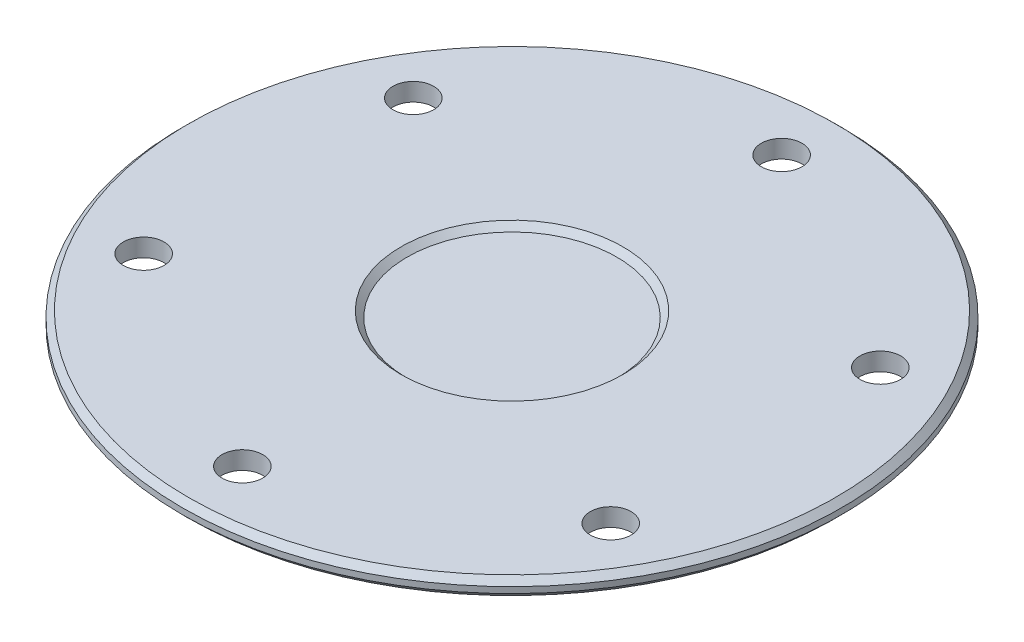
from build123d import *

# Parameters (mm, degrees)
SKETCH_1_R               = 55
EXTRUDE_1_DEPTH          = 3
PATTERN_CIRCULAR_1_COUNT = 6
SKETCH_5_R               = 17.5
CUT_EXTRUDE_1_DEPTH      = 1
CHAMFER_1_SIZE           = 1


with BuildPart() as part:
    # 草图1 → 凸台-拉伸1 (new body)
    with BuildSketch(Plane(origin=(0, 0, 0), x_dir=(1, 0, 0), z_dir=(0, 1, 0))):
        with Locations(Location((0, 0, 0), (0, 0, 270))):
            Circle(SKETCH_1_R)
    extrude(amount=EXTRUDE_1_DEPTH)

    # 草图4 → M8 螺纹孔的螺纹孔钻头1 (revolve, cut)
    with BuildSketch(Plane(origin=(0, 3, -45), x_dir=(0, 0, 1), z_dir=(1, 0, 0))):
        Polygon((0, 0), (0, 18.042926105), (3.4, 16), (3.4, 0), align=None)
    hole_wizard_m8_1 = revolve(axis=Axis((0, 9.35, -45), (0, -1, 0)), mode=Mode.SUBTRACT)

    # 阵列(圆周)1: M8 螺纹孔的螺纹孔钻头1 ×6 about axis
    pattern_circular_1_axis = Axis((0, 0, 0), (0, 1, 0))
    for i in range(1, PATTERN_CIRCULAR_1_COUNT):
        add(hole_wizard_m8_1.rotate(pattern_circular_1_axis, i * 360 / PATTERN_CIRCULAR_1_COUNT), mode=Mode.SUBTRACT)

    # 草图5 → 切除-拉伸1 (cut)
    with BuildSketch(Plane(origin=(0, 3, 0), x_dir=(1, 0, 0), z_dir=(0, 1, 0))):
        with Locations(Location((0, 0, 0), (0, 0, 270))):
            Circle(SKETCH_5_R)
    extrude(amount=-CUT_EXTRUDE_1_DEPTH, mode=Mode.SUBTRACT)

    # 倒角1
    chamfer_1_edges = [part.edges().sort_by_distance(p)[0] for p in [
        (0, 0, -55),
        (0, 3, -17.5),
        (0, 3, -55),
    ]]
    chamfer(chamfer_1_edges, length=CHAMFER_1_SIZE - 0.0001)  # a hair under: the kernel refuses the full size


solid = part.part
